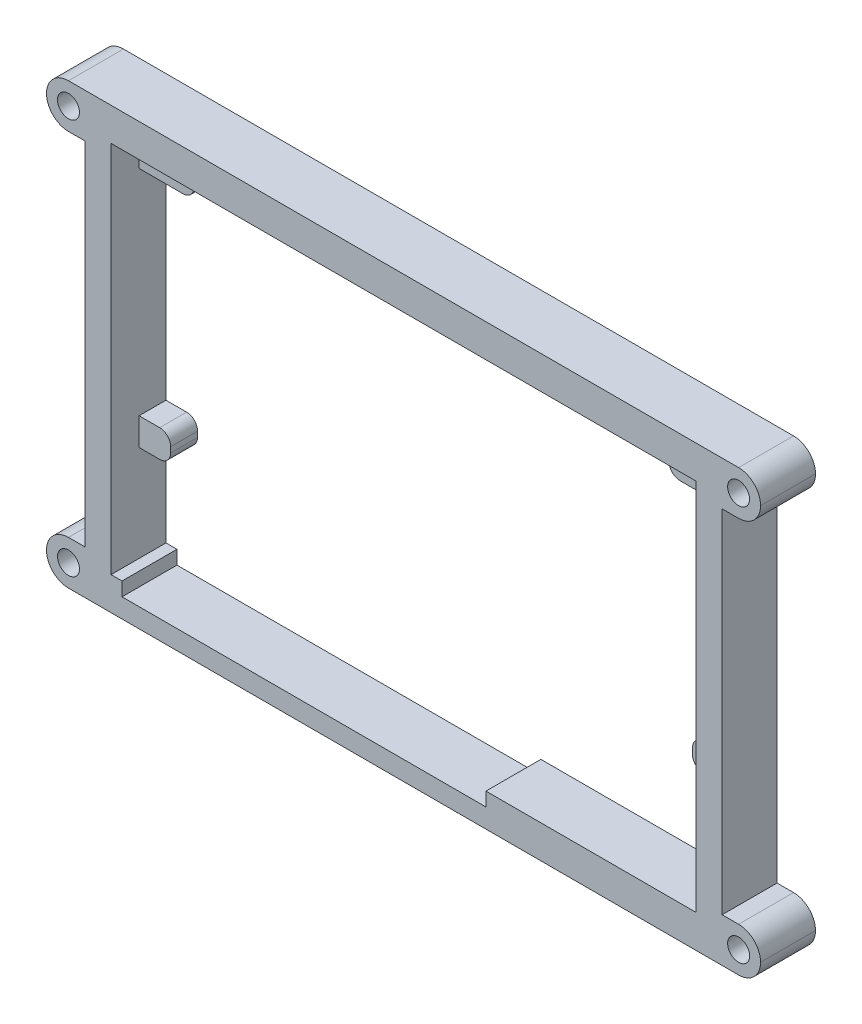
from build123d import *

# Parameters (mm, degrees)
SKETCH1_W             = 130
SKETCH1_H             = 80
BOSS_EXTRUDE1_DEPTH   = 10
FILLET1_R             = 4
F_4_0MM_DOWEL_HOLE1_D = 4
MIRROR2_COPY_1_D      = 4
SKETCH8_W             = 95
SKETCH8_H             = 55
CUT_EXTRUDE4_DEPTH    = 10
SKETCH4_W             = 106.5
SKETCH4_H             = 68
CUT_EXTRUDE1_DEPTH    = 5.1
SKETCH6_W             = 7
SKETCH6_H             = 64
CUT_EXTRUDE3_DEPTH    = 10
FILLET3_R             = 4
SKETCH10_W            = 66.25
SKETCH10_H            = 2.5
CUT_EXTRUDE6_DEPTH    = 10
SKETCH12_W            = 5.983903777
SKETCH12_H            = 17.5
SKETCH12_W_2          = 5.75
SKETCH12_H_2          = 39
CUT_EXTRUDE7_DEPTH    = 10
SKETCH13_W            = 86.5
SKETCH13_H            = 6.5
CUT_EXTRUDE8_DEPTH    = 10
SKETCH14_W            = 5.75
SKETCH14_H            = 39
CUT_EXTRUDE9_DEPTH    = 10
SKETCH15_W            = 5.75
SKETCH15_H            = 17.5
CUT_EXTRUDE10_DEPTH   = 10
SKETCH16_W            = 94.766096223
SKETCH16_H            = 6.5
CUT_EXTRUDE11_DEPTH   = 10
FILLET4_R             = 2


with BuildPart() as part:
    # Sketch1 → Boss-Extrude1 (new body)
    with BuildSketch(Plane.XY):
        Rectangle(SKETCH1_W, SKETCH1_H)
    extrude(amount=BOSS_EXTRUDE1_DEPTH)

    # Fillet1
    fillet1_edges = [part.edges().sort_by_distance(p)[0] for p in [
        (65, -40, 5),
        (-65, -40, 5),
        (-65, 40, 5),
        (65, 40, 5),
    ]]
    fillet(fillet1_edges, radius=FILLET1_R)

    # Ø4.0mm Dowel Hole1 (through all)
    with Locations(Plane.XY.offset(10)):
        with Locations((-61, 36)):
            f_4_0mm_dowel_hole1 = Hole(F_4_0MM_DOWEL_HOLE1_D / 2)

    # Mirror1: Ø4.0mm Dowel Hole1 across plane
    add(f_4_0mm_dowel_hole1.mirror(Plane(origin=(0, 0, 0), x_dir=(0, 0, 1), z_dir=(1, 0, 0))), mode=Mode.SUBTRACT)

    # Mirror2: Ø4.0mm Dowel Hole1 across plane
    add(f_4_0mm_dowel_hole1.mirror(Plane.ZX), mode=Mode.SUBTRACT)

    # Mirror2 copy 1 (through all)
    with Locations(Plane(origin=(0, 0, 10), x_dir=(-1, 0, 0), z_dir=(0, 0, 1))):
        with Locations((-61, 36)):
            Hole(MIRROR2_COPY_1_D / 2)

    # Sketch8 → Cut-Extrude4 (cut)
    with BuildSketch(Plane.XY.offset(10)):
        Rectangle(SKETCH8_W, SKETCH8_H)
    extrude(amount=-CUT_EXTRUDE4_DEPTH, mode=Mode.SUBTRACT)

    # Sketch4 → Cut-Extrude1 (cut)
    with BuildSketch(Plane.XY.offset(10)):
        Rectangle(SKETCH4_W, SKETCH4_H)
    extrude(amount=-CUT_EXTRUDE1_DEPTH, mode=Mode.SUBTRACT)

    # Sketch6 → Cut-Extrude3 (cut)
    with BuildSketch(Plane.XY.offset(10)):
        with Locations((61.5, 0)):
            Rectangle(SKETCH6_W, SKETCH6_H)
    cut_extrude3 = extrude(amount=-CUT_EXTRUDE3_DEPTH, mode=Mode.SUBTRACT)

    # Mirror6: Cut-Extrude3 across plane
    add(cut_extrude3.mirror(Plane(origin=(0, 0, 0), x_dir=(0, 0, 1), z_dir=(1, 0, 0))), mode=Mode.SUBTRACT)

    # Fillet3
    fillet3_edges = [part.edges().sort_by_distance(p)[0] for p in [
        (65, -32, 5),
        (65, 32, 5),
        (-65, -32, 5),
        (-65, 32, 5),
    ]]
    fillet(fillet3_edges, radius=FILLET3_R - 0.0001)  # a hair under: the kernel refuses the full size

    # Sketch10 → Cut-Extrude6 (cut)
    with BuildSketch(Plane.XY.offset(10)):
        with Locations((-18.125, -35.25)):
            Rectangle(SKETCH10_W, SKETCH10_H)
    extrude(amount=-CUT_EXTRUDE6_DEPTH, mode=Mode.SUBTRACT)

    # Sketch12 → Cut-Extrude7 (cut)
    with BuildSketch(Plane.XY.offset(4.9)):
        with Locations((-50.258048112, -25.25)):
            Rectangle(SKETCH12_W, SKETCH12_H)
        with Locations((-50.375, 8)):
            Rectangle(SKETCH12_W_2, SKETCH12_H_2)
    extrude(amount=-CUT_EXTRUDE7_DEPTH, mode=Mode.SUBTRACT)

    # Sketch13 → Cut-Extrude8 (cut)
    with BuildSketch(Plane.XY.offset(4.9)):
        with Locations((0, 30.75)):
            Rectangle(SKETCH13_W, SKETCH13_H)
    extrude(amount=-CUT_EXTRUDE8_DEPTH, mode=Mode.SUBTRACT)

    # Sketch14 → Cut-Extrude9 (cut)
    with BuildSketch(Plane.XY.offset(4.9)):
        with Locations((50.375, 8)):
            Rectangle(SKETCH14_W, SKETCH14_H)
    extrude(amount=-CUT_EXTRUDE9_DEPTH, mode=Mode.SUBTRACT)

    # Sketch15 → Cut-Extrude10 (cut)
    with BuildSketch(Plane.XY.offset(4.9)):
        with Locations((50.375, -25.25)):
            Rectangle(SKETCH15_W, SKETCH15_H)
    extrude(amount=-CUT_EXTRUDE10_DEPTH, mode=Mode.SUBTRACT)

    # Sketch16 → Cut-Extrude11 (cut)
    with BuildSketch(Plane.XY.offset(4.9)):
        with Locations((0.116951888, -30.75)):
            Rectangle(SKETCH16_W, SKETCH16_H)
    extrude(amount=-CUT_EXTRUDE11_DEPTH, mode=Mode.SUBTRACT)

    # Fillet4
    fillet4_edges = [part.edges().sort_by_distance(p)[0] for p in [
        (-47.5, -16.5, 2.45),
        (-47.5, -11.5, 2.45),
        (43.25, 27.5, 2.45),
        (-43.25, 27.5, 2.45),
        (47.5, -11.5, 2.45),
        (47.5, -16.5, 2.45),
    ]]
    fillet(fillet4_edges, radius=FILLET4_R)


solid = part.part
